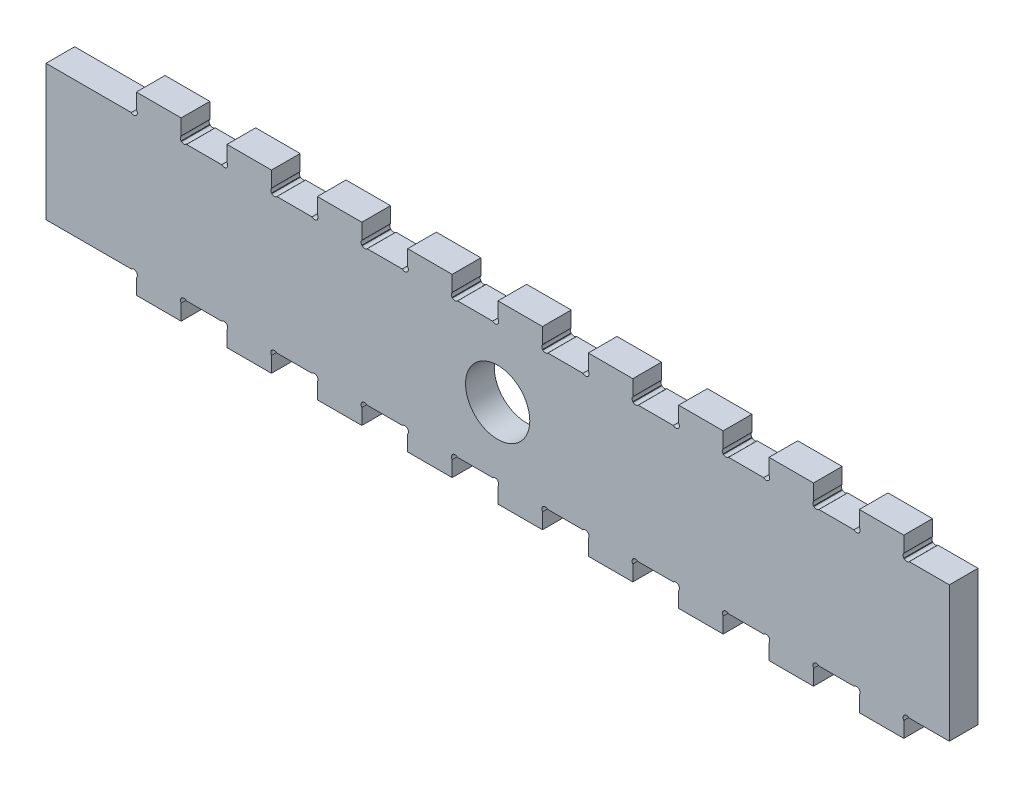
from build123d import *

# Parameters (mm, degrees)
BOSS_EXTRUDE1_DEPTH = 6.35
SKETCH1_R           = 7.112
CUT_EXTRUDE1_DEPTH  = 6.35
SKETCH2_W           = 10.1524
SKETCH2_H           = 7.304058312
SKETCH2_H_2         = 7.377109797
CUT_EXTRUDE2_DEPTH  = 204.051450213
LPATTERN1_COUNT     = 9
LPATTERN1_PITCH     = 20
SKETCH3_W           = 0.405797101
SKETCH3_H           = 2.992753623
CUT_EXTRUDE3_DEPTH  = 2.54


# Read off the part's stored shape, not the designer's step: Boss-Extrude1
with BuildPart() as part:
    # Boss-Extrude1 outline → Boss-Extrude1 (new body)
    with BuildSketch(Plane.XY):
        with BuildLine():
            Line((190, -4.490128061), (190, -1.122532015))
            ThreePointArc((190, -1.122532015), (190, 0), (191.122532015, 0))
            Line((191.122532015, 0), (200, 0))
            Line((200, 0), (200, 30))
            Line((200, 30), (191.122532015, 30))
            ThreePointArc((191.122532015, 30), (190, 30), (190, 31.122532015))
            Line((190, 31.122532015), (190, 34.490128061))
            Line((190, 34.490128061), (180, 34.490128061))
            Line((180, 34.490128061), (180, 31.122532015))
            ThreePointArc((180, 31.122532015), (180, 30), (178.877467985, 30))
            Line((178.877467985, 30), (171.122532015, 30))
            ThreePointArc((171.122532015, 30), (170, 30), (170, 31.122532015))
            Line((170, 31.122532015), (170, 34.490128061))
            Line((170, 34.490128061), (160, 34.490128061))
            Line((160, 34.490128061), (160, 31.122532015))
            ThreePointArc((160, 31.122532015), (160, 30), (158.877467985, 30))
            Line((158.877467985, 30), (151.122532015, 30))
            ThreePointArc((151.122532015, 30), (150, 30), (150, 31.122532015))
            Line((150, 31.122532015), (150, 34.490128061))
            Line((150, 34.490128061), (140, 34.490128061))
            Line((140, 34.490128061), (140, 31.122532015))
            ThreePointArc((140, 31.122532015), (140, 30), (138.877467985, 30))
            Line((138.877467985, 30), (131.122532015, 30))
            ThreePointArc((131.122532015, 30), (130, 30), (130, 31.122532015))
            Line((130, 31.122532015), (130, 34.490128061))
            Line((130, 34.490128061), (120, 34.490128061))
            Line((120, 34.490128061), (120, 31.122532015))
            ThreePointArc((120, 31.122532015), (120, 30), (118.877467985, 30))
            Line((118.877467985, 30), (111.122532015, 30))
            ThreePointArc((111.122532015, 30), (110, 30), (110, 31.122532015))
            Line((110, 31.122532015), (110, 34.490128061))
            Line((110, 34.490128061), (100, 34.490128061))
            Line((100, 34.490128061), (100, 31.122532015))
            ThreePointArc((100, 31.122532015), (100, 30), (98.877467985, 30))
            Line((98.877467985, 30), (91.122532015, 30))
            ThreePointArc((91.122532015, 30), (90, 30), (90, 31.122532015))
            Line((90, 31.122532015), (90, 34.490128061))
            Line((90, 34.490128061), (80, 34.490128061))
            Line((80, 34.490128061), (80, 31.122532015))
            ThreePointArc((80, 31.122532015), (80, 30), (78.877467985, 30))
            Line((78.877467985, 30), (71.122532015, 30))
            ThreePointArc((71.122532015, 30), (70, 30), (70, 31.122532015))
            Line((70, 31.122532015), (70, 34.490128061))
            Line((70, 34.490128061), (60, 34.490128061))
            Line((60, 34.490128061), (60, 31.122532015))
            ThreePointArc((60, 31.122532015), (60, 30), (58.877467985, 30))
            Line((58.877467985, 30), (51.122532015, 30))
            ThreePointArc((51.122532015, 30), (50, 30), (50, 31.122532015))
            Line((50, 31.122532015), (50, 34.490128061))
            Line((50, 34.490128061), (40, 34.490128061))
            Line((40, 34.490128061), (40, 31.122532015))
            ThreePointArc((40, 31.122532015), (40, 30), (38.877467985, 30))
            Line((38.877467985, 30), (31.122532015, 30))
            ThreePointArc((31.122532015, 30), (30, 30), (30, 31.122532015))
            Line((30, 31.122532015), (30, 34.490128061))
            Line((30, 34.490128061), (20, 34.490128061))
            Line((20, 34.490128061), (20, 31.122532015))
            ThreePointArc((20, 31.122532015), (20, 30), (18.877467985, 30))
            Line((18.877467985, 30), (0, 30))
            Line((0, 30), (0, 0))
            Line((0, 0), (18.877467985, 0))
            ThreePointArc((18.877467985, 0), (20, 0), (20, -1.122532015))
            Line((20, -1.122532015), (20, -4.490128061))
            Line((20, -4.490128061), (30, -4.490128061))
            Line((30, -4.490128061), (30, -1.122532015))
            ThreePointArc((30, -1.122532015), (30, 0), (31.122532015, 0))
            Line((31.122532015, 0), (38.877467985, 0))
            ThreePointArc((38.877467985, 0), (40, 0), (40, -1.122532015))
            Line((40, -1.122532015), (40, -4.490128061))
            Line((40, -4.490128061), (50, -4.490128061))
            Line((50, -4.490128061), (50, -1.122532015))
            ThreePointArc((50, -1.122532015), (50, 0), (51.122532015, 0))
            Line((51.122532015, 0), (58.877467985, 0))
            ThreePointArc((58.877467985, 0), (60, 0), (60, -1.122532015))
            Line((60, -1.122532015), (60, -4.490128061))
            Line((60, -4.490128061), (70, -4.490128061))
            Line((70, -4.490128061), (70, -1.122532015))
            ThreePointArc((70, -1.122532015), (70, 0), (71.122532015, 0))
            Line((71.122532015, 0), (78.877467985, 0))
            ThreePointArc((78.877467985, 0), (80, 0), (80, -1.122532015))
            Line((80, -1.122532015), (80, -4.490128061))
            Line((80, -4.490128061), (90, -4.490128061))
            Line((90, -4.490128061), (90, -1.122532015))
            ThreePointArc((90, -1.122532015), (90, 0), (91.122532015, 0))
            Line((91.122532015, 0), (98.877467985, 0))
            ThreePointArc((98.877467985, 0), (100, 0), (100, -1.122532015))
            Line((100, -1.122532015), (100, -4.490128061))
            Line((100, -4.490128061), (110, -4.490128061))
            Line((110, -4.490128061), (110, -1.122532015))
            ThreePointArc((110, -1.122532015), (110, 0), (111.122532015, 0))
            Line((111.122532015, 0), (118.877467985, 0))
            ThreePointArc((118.877467985, 0), (120, 0), (120, -1.122532015))
            Line((120, -1.122532015), (120, -4.490128061))
            Line((120, -4.490128061), (130, -4.490128061))
            Line((130, -4.490128061), (130, -1.122532015))
            ThreePointArc((130, -1.122532015), (130, 0), (131.122532015, 0))
            Line((131.122532015, 0), (138.877467985, 0))
            ThreePointArc((138.877467985, 0), (140, 0), (140, -1.122532015))
            Line((140, -1.122532015), (140, -4.490128061))
            Line((140, -4.490128061), (150, -4.490128061))
            Line((150, -4.490128061), (150, -1.122532015))
            ThreePointArc((150, -1.122532015), (150, 0), (151.122532015, 0))
            Line((151.122532015, 0), (158.877467985, 0))
            ThreePointArc((158.877467985, 0), (160, 0), (160, -1.122532015))
            Line((160, -1.122532015), (160, -4.490128061))
            Line((160, -4.490128061), (170, -4.490128061))
            Line((170, -4.490128061), (170, -1.122532015))
            ThreePointArc((170, -1.122532015), (170, 0), (171.122532015, 0))
            Line((171.122532015, 0), (178.877467985, 0))
            ThreePointArc((178.877467985, 0), (180, 0), (180, -1.122532015))
            Line((180, -1.122532015), (180, -4.490128061))
            Line((180, -4.490128061), (190, -4.490128061))
        make_face()
    extrude(amount=BOSS_EXTRUDE1_DEPTH)

    # Sketch1 → Cut-Extrude1 (cut)
    with BuildSketch(Plane.XY.offset(6.35)):
        with Locations((100, 15)):
            Circle(SKETCH1_R)
    extrude(amount=-CUT_EXTRUDE1_DEPTH, mode=Mode.SUBTRACT)

    # Sketch2 → Cut-Extrude2 (cut, through all)
    with BuildSketch(Plane(origin=(0, 0, 0), x_dir=(-1, 0, 0), z_dir=(0, 0, -1))):
        with Locations((-35, 33.652029156)):
            Rectangle(SKETCH2_W, SKETCH2_H)
        with Locations((-35, -3.688554899)):
            Rectangle(SKETCH2_W, SKETCH2_H_2)
    cut_extrude2 = extrude(amount=-CUT_EXTRUDE2_DEPTH, mode=Mode.SUBTRACT)

    # LPattern1: Cut-Extrude2 ×9
    with Locations(*[(i * LPATTERN1_PITCH, 0, 0) for i in range(1, LPATTERN1_COUNT)]):
        add(cut_extrude2, mode=Mode.SUBTRACT)

    # Sketch3 → Cut-Extrude3 (cut)
    # profile 1 of 7: a face of its own
    with BuildSketch(Plane(origin=(0, 0, 0), x_dir=(-1, 0, 0), z_dir=(0, 0, -1))):
        with BuildLine():
            add(Edge.make_bspline(
                [(-198.628550725, 24.369565217), (-198.652091106, 24.439191511), (-198.699135289, 24.578335901), (-198.745555146, 24.794359971), (-198.775410316, 25.014667784), (-198.778944977, 25.163359913), (-198.780724638, 25.238224638)],
                knots=[0, 0, 0, 0, 0.994488486, 1.987431555, 2.986695647, 4, 4, 4, 4], degree=3))
            add(Edge.make_bspline(
                [(-198.780724638, 25.238224638), (-198.779347085, 25.297460952), (-198.776663168, 25.412872458), (-198.756085396, 25.580662162), (-198.721119452, 25.737744864), (-198.673168798, 25.884474831), (-198.610110067, 26.020428138), (-198.532689936, 26.145543054), (-198.441960032, 26.260398052), (-198.337221232, 26.364303624), (-198.218447884, 26.456463783), (-198.086243147, 26.536614633), (-197.940656127, 26.604476934), (-197.781519009, 26.658475676), (-197.609441868, 26.701242062), (-197.424480067, 26.731816669), (-197.226065436, 26.750081143), (-197.089415041, 26.752416825), (-197.018836051, 26.753623188)],
                knots=[0, 0, 0, 0, 1.072521388, 2.089618652, 3.055324458, 3.982727964, 4.879567488, 5.762479147, 6.641155072, 7.524105616, 8.427505607, 9.357127668, 10.318129176, 11.330308756, 12.395495865, 13.525717698, 14.722050183, 16, 16, 16, 16], degree=3))
            add(Edge.make_bspline(
                [(-197.018836051, 26.753623188), (-196.950103159, 26.752155775), (-196.815516836, 26.749282423), (-196.618803095, 26.729705951), (-196.432233617, 26.695550584), (-196.256545532, 26.648126232), (-196.091928662, 26.588981407), (-195.939702067, 26.517586195), (-195.800493439, 26.434277415), (-195.674329672, 26.33965593), (-195.561855768, 26.233370591), (-195.462239526, 26.116752761), (-195.377108527, 25.988802962), (-195.305406147, 25.85136377), (-195.248937918, 25.704059913), (-195.208791146, 25.547722279), (-195.183349726, 25.382777221), (-195.180652245, 25.269758309), (-195.179275362, 25.212069746)],
                knots=[0, 0, 0, 0, 1.219601586, 2.388109825, 3.503461938, 4.581531402, 5.613672394, 6.603499858, 7.560235823, 8.487517701, 9.396185618, 10.300781163, 11.203126632, 12.117328385, 13.046279645, 13.9957175, 14.976948417, 16, 16, 16, 16], degree=3))
            add(Edge.make_bspline(
                [(-195.179275362, 25.212069746), (-195.17969203, 25.17269137), (-195.180512088, 25.095189507), (-195.188153972, 24.981275299), (-195.198571411, 24.871381126), (-195.221082705, 24.731979193), (-195.25962679, 24.562811061), (-195.307559555, 24.433842986), (-195.331449275, 24.369565217)],
                knots=[0, 0, 0, 0, 0.822626155, 1.619037258, 2.384688107, 3.12792479, 4.568555946, 6, 6, 6, 6], degree=3))
            Line((-195.331449275, 24.369565217), (-195.787971014, 24.369565217))
            add(Edge.make_bspline(
                [(-195.787971014, 24.369565217), (-195.771985551, 24.400815403), (-195.740307718, 24.462742802), (-195.699927539, 24.55872837), (-195.664844647, 24.655975609), (-195.63631946, 24.755860436), (-195.612971413, 24.858698111), (-195.59632813, 24.965914875), (-195.586881132, 25.077687731), (-195.585681673, 25.153665912), (-195.585072464, 25.192255435)],
                knots=[0, 0, 0, 0, 0.983572694, 1.949111623, 2.916466222, 3.879730749, 4.858833143, 5.870548135, 6.918445666, 8, 8, 8, 8], degree=3))
            add(Edge.make_bspline(
                [(-195.585072464, 25.192255435), (-195.585947203, 25.231700985), (-195.58766552, 25.309186906), (-195.606833914, 25.42204973), (-195.635816185, 25.5293889), (-195.677440027, 25.630349389), (-195.729539701, 25.725178012), (-195.793789159, 25.812032779), (-195.867958619, 25.89181496), (-195.952664586, 25.964135823), (-196.047006936, 26.029350904), (-196.152107873, 26.085484325), (-196.26639413, 26.135049627), (-196.391146352, 26.174629457), (-196.524711114, 26.207645601), (-196.667626451, 26.230094657), (-196.819636076, 26.243650033), (-196.923962023, 26.245450657), (-196.977622283, 26.246376812)],
                knots=[0, 0, 0, 0, 0.961465539, 1.888680529, 2.784722735, 3.669285122, 4.546395053, 5.417897658, 6.298128314, 7.19861075, 8.13011739, 9.090545283, 10.101099583, 11.165124917, 12.279780303, 13.454963993, 14.690955624, 16, 16, 16, 16], degree=3))
            add(Edge.make_bspline(
                [(-196.977622283, 26.246376812), (-197.03365404, 26.245720053), (-197.142173332, 26.244448078), (-197.299710917, 26.231720546), (-197.446551705, 26.210220218), (-197.583433317, 26.181957695), (-197.708874063, 26.142243707), (-197.824889035, 26.097352966), (-197.929117691, 26.04111991), (-198.023311652, 25.977915687), (-198.106482041, 25.906160975), (-198.17860395, 25.825998331), (-198.239913979, 25.738003899), (-198.289142503, 25.641506693), (-198.328612289, 25.538040835), (-198.354730778, 25.426035645), (-198.372063314, 25.306662465), (-198.373955209, 25.22428789), (-198.374927536, 25.181951993)],
                knots=[0, 0, 0, 0, 1.344734694, 2.604409767, 3.789983137, 4.905641868, 5.954647261, 6.944970549, 7.886844079, 8.790877712, 9.663034665, 10.516172657, 11.372838457, 12.229363423, 13.110351235, 14.023942263, 14.984417489, 16, 16, 16, 16], degree=3))
            add(Edge.make_bspline(
                [(-198.374927536, 25.181951993), (-198.374407016, 25.145466), (-198.373375149, 25.073137135), (-198.36240331, 24.965710061), (-198.346128184, 24.860567922), (-198.315197481, 24.724029413), (-198.261925741, 24.557868516), (-198.202009226, 24.432363681), (-198.172028986, 24.369565217)],
                knots=[0, 0, 0, 0, 0.776679327, 1.539668523, 2.297162527, 3.040996235, 4.519412489, 6, 6, 6, 6], degree=3))
            Line((-198.172028986, 24.369565217), (-198.628550725, 24.369565217))
        make_face()
    # profile 2 of 7: a face of its own
    with BuildSketch(Plane(origin=(0, 0, 0), x_dir=(-1, 0, 0), z_dir=(0, 0, -1))):
        Polygon((-195.635797101, 22.746376812), (-195.635797101, 23.557971014), (-195.23, 23.557971014), (-195.23, 21.427536232), (-195.635797101, 21.427536232), (-195.635797101, 22.239130435), (-198.324202899, 22.239130435), (-198.324202899, 21.427536232), (-198.73, 21.427536232), (-198.73, 23.557971014), (-198.324202899, 23.557971014), (-198.324202899, 22.746376812), align=None)
    # profile 3 of 7: a face of its own
    with BuildSketch(Plane(origin=(0, 0, 0), x_dir=(-1, 0, 0), z_dir=(0, 0, -1))):
        with Locations((-199.643043479, 19.525362319)):
            Rectangle(SKETCH3_W, SKETCH3_H)
    # profile 4 of 7: a face of its own
    with BuildSketch(Plane(origin=(0, 0, 0), x_dir=(-1, 0, 0), z_dir=(0, 0, -1))):
        Polygon((-198.73, 15.061594203), (-198.73, 15.580729167), (-197.969130435, 15.815330616), (-197.969130435, 17.268908514), (-198.73, 17.509057971), (-198.73, 18.003623188), (-195.23, 16.840126812), (-195.23, 16.187839674), align=None)
        Polygon((-197.563333333, 15.939764493), (-195.638174819, 16.532608696), (-197.563333333, 17.140511775), align=None, mode=Mode.SUBTRACT)
    # profile 5 of 7: a face of its own
    with BuildSketch(Plane(origin=(0, 0, 0), x_dir=(-1, 0, 0), z_dir=(0, 0, -1))):
        with BuildLine():
            add(Edge.make_bspline(
                [(-195.787971014, 12.297101449), (-195.758065487, 12.364719535), (-195.698633579, 12.499098433), (-195.644593663, 12.675388841), (-195.613753257, 12.820356717), (-195.597331573, 12.934200304), (-195.586620083, 13.052745172), (-195.585593364, 13.133505723), (-195.585072464, 13.174479167)],
                knots=[0, 0, 0, 0, 1.464330601, 2.910096185, 3.643252908, 4.399959025, 5.188227586, 6, 6, 6, 6], degree=3))
            add(Edge.make_bspline(
                [(-195.585072464, 13.174479167), (-195.586204516, 13.221050347), (-195.588414289, 13.311957546), (-195.60808439, 13.443881629), (-195.63848755, 13.568305963), (-195.683210034, 13.684022313), (-195.739190866, 13.791640272), (-195.804700579, 13.891532237), (-195.882477857, 13.981229151), (-195.969296167, 14.062584915), (-196.065970817, 14.135209996), (-196.172349831, 14.19846706), (-196.288238068, 14.252489271), (-196.41265626, 14.297421392), (-196.545176904, 14.333210714), (-196.684977312, 14.357871625), (-196.831379531, 14.37469955), (-196.9313393, 14.376097709), (-196.982377717, 14.376811594)],
                knots=[0, 0, 0, 0, 1.07383125, 2.096124485, 3.070298713, 4.02338534, 4.950249423, 5.864786912, 6.772474448, 7.682348964, 8.605135898, 9.556349748, 10.532485908, 11.550518582, 12.604692889, 13.695003331, 14.823092702, 16, 16, 16, 16], degree=3))
            add(Edge.make_bspline(
                [(-196.982377717, 14.376811594), (-197.035502414, 14.376086857), (-197.138721763, 14.374678718), (-197.289623519, 14.362719164), (-197.431811509, 14.342401257), (-197.565542842, 14.31380728), (-197.690327166, 14.278140983), (-197.805382333, 14.231992465), (-197.910391713, 14.176195045), (-198.006375184, 14.112375027), (-198.090800818, 14.037780546), (-198.165706995, 13.954709422), (-198.229039049, 13.861117618), (-198.282931715, 13.758279391), (-198.32370158, 13.64453419), (-198.354083613, 13.521124466), (-198.371165562, 13.386834118), (-198.373643612, 13.293940567), (-198.374927536, 13.245810688)],
                knots=[0, 0, 0, 0, 1.243320526, 2.415726445, 3.540355266, 4.602811121, 5.614475227, 6.574453135, 7.498382402, 8.393662059, 9.265660112, 10.128400087, 11.004859636, 11.903741185, 12.83886003, 13.825727115, 14.873468712, 16, 16, 16, 16], degree=3))
            add(Edge.make_bspline(
                [(-198.374927536, 13.245810688), (-198.374546099, 13.228103531), (-198.373753956, 13.191330453), (-198.369601191, 13.134759476), (-198.363477223, 13.076043864), (-198.354611486, 13.01715216), (-198.344537474, 12.959168116), (-198.33214436, 12.90354218), (-198.317385242, 12.851989225), (-198.30586241, 12.819620154), (-198.300425725, 12.804347826)],
                knots=[0, 0, 0, 0, 0.945094064, 1.962710246, 3.026179144, 4.094962389, 5.140426656, 6.16660256, 7.134969076, 8, 8, 8, 8], degree=3))
            Line((-198.300425725, 12.804347826), (-197.157536232, 12.804347826))
            Line((-197.157536232, 12.804347826), (-197.157536232, 13.508152174))
            Line((-197.157536232, 13.508152174), (-196.75173913, 13.508152174))
            Line((-196.75173913, 13.508152174), (-196.75173913, 12.297101449))
            Line((-196.75173913, 12.297101449), (-198.5659375, 12.297101449))
            add(Edge.make_bspline(
                [(-198.5659375, 12.297101449), (-198.582790401, 12.335215917), (-198.617018388, 12.412625824), (-198.660080531, 12.53373683), (-198.69700215, 12.659239877), (-198.728069011, 12.787463063), (-198.751627607, 12.916636127), (-198.768020126, 13.045237595), (-198.778979056, 13.17111834), (-198.780150817, 13.25424325), (-198.780724638, 13.294950181)],
                knots=[0, 0, 0, 0, 0.972423304, 1.974976993, 2.997359869, 4.024843793, 5.052901157, 6.060203398, 7.050066144, 8, 8, 8, 8], degree=3))
            add(Edge.make_bspline(
                [(-198.780724638, 13.294950181), (-198.779450472, 13.354729442), (-198.776961194, 13.471517411), (-198.754725954, 13.641989994), (-198.720516493, 13.80351653), (-198.671243232, 13.95579251), (-198.607947956, 14.097650755), (-198.531321426, 14.229291271), (-198.440484864, 14.349446549), (-198.335921929, 14.458712654), (-198.217922417, 14.55663089), (-198.086258356, 14.642930726), (-197.940317289, 14.715275915), (-197.78155806, 14.776818182), (-197.609245408, 14.824709198), (-197.423938433, 14.859418785), (-197.225636355, 14.88006195), (-197.089160952, 14.882699077), (-197.018836051, 14.884057971)],
                knots=[0, 0, 0, 0, 1.06370665, 2.078114337, 3.054979398, 3.999380594, 4.92145651, 5.815163411, 6.704963933, 7.596415903, 8.501447596, 9.428880987, 10.392157234, 11.395659057, 12.455751986, 13.570903998, 14.748302397, 16, 16, 16, 16], degree=3))
            add(Edge.make_bspline(
                [(-197.018836051, 14.884057971), (-196.948763813, 14.882522928), (-196.811664769, 14.879519556), (-196.611913448, 14.856504497), (-196.423212345, 14.817801115), (-196.246648094, 14.763062563), (-196.081834859, 14.694893777), (-195.929970855, 14.613954562), (-195.79053864, 14.520841342), (-195.665096638, 14.414168023), (-195.552726883, 14.295791518), (-195.454879074, 14.16548349), (-195.369917255, 14.024630708), (-195.301564173, 13.871772551), (-195.246983539, 13.710133059), (-195.206759429, 13.539910352), (-195.183965013, 13.3613579), (-195.18085511, 13.239533151), (-195.179275362, 13.177649457)],
                knots=[0, 0, 0, 0, 1.187685027, 2.323751684, 3.40325322, 4.448706947, 5.452612453, 6.422370454, 7.361444742, 8.289291529, 9.2080357, 10.122578476, 11.046580091, 11.990639292, 12.95512931, 13.935010878, 14.951041083, 16, 16, 16, 16], degree=3))
            add(Edge.make_bspline(
                [(-195.179275362, 13.177649457), (-195.180706246, 13.098828558), (-195.183510171, 12.944372973), (-195.208032801, 12.75437246), (-195.235079926, 12.60817197), (-195.261684758, 12.50217479), (-195.292921339, 12.398279939), (-195.318625898, 12.330777013), (-195.331449275, 12.297101449)],
                knots=[0, 0, 0, 0, 1.577575484, 3.091379944, 3.829084024, 4.554025386, 5.278638522, 6, 6, 6, 6], degree=3))
            Line((-195.331449275, 12.297101449), (-195.787971014, 12.297101449))
        make_face()
    # profile 6 of 7: a face of its own
    with BuildSketch(Plane(origin=(0, 0, 0), x_dir=(-1, 0, 0), z_dir=(0, 0, -1))):
        Polygon((-198.73, 9.076086957), (-198.73, 9.59522192), (-197.969130435, 9.82982337), (-197.969130435, 11.283401268), (-198.73, 11.523550725), (-198.73, 12.018115942), (-195.23, 10.854619565), (-195.23, 10.202332428), align=None)
        Polygon((-197.563333333, 9.954257246), (-195.638174819, 10.547101449), (-197.563333333, 11.155004529), align=None, mode=Mode.SUBTRACT)
    # profile 7 of 7: a face of its own
    with BuildSketch(Plane(origin=(0, 0, 0), x_dir=(-1, 0, 0), z_dir=(0, 0, -1))):
        with BuildLine():
            Line((-198.73, 6.260869565), (-198.73, 6.798233696))
            Line((-198.73, 6.798233696), (-197.637042572, 7.30151721))
            add(Edge.make_bspline(
                [(-197.637042572, 7.30151721), (-197.598368814, 7.319810479), (-197.526751264, 7.353686655), (-197.431428969, 7.411807065), (-197.356587471, 7.47446239), (-197.29692141, 7.540310826), (-197.255318839, 7.613431291), (-197.226920805, 7.692560342), (-197.211328641, 7.779614455), (-197.20931373, 7.840404486), (-197.20826087, 7.872169384)],
                knots=[0, 0, 0, 0, 1.338772992, 2.479191189, 3.482945241, 4.385349486, 5.244905147, 6.097671477, 7.005967435, 8, 8, 8, 8], degree=3))
            Line((-197.20826087, 7.872169384), (-197.20826087, 8.086956522))
            Line((-197.20826087, 8.086956522), (-198.73, 8.086956522))
            Line((-198.73, 8.086956522), (-198.73, 8.594202899))
            Line((-198.73, 8.594202899), (-195.23, 8.594202899))
            Line((-195.23, 8.594202899), (-195.23, 7.663722826))
            add(Edge.make_bspline(
                [(-195.23, 7.663722826), (-195.230633681, 7.614816511), (-195.231855432, 7.520524022), (-195.244733393, 7.384374104), (-195.265510948, 7.258872503), (-195.2958998, 7.144203961), (-195.333062074, 7.039620985), (-195.377372069, 6.944664355), (-195.429106457, 6.859489304), (-195.486866488, 6.783574017), (-195.551695183, 6.717889924), (-195.622982227, 6.662033336), (-195.700206337, 6.614757232), (-195.784086439, 6.577732402), (-195.87286988, 6.549177769), (-195.966715871, 6.529823378), (-196.064721142, 6.516409727), (-196.131900557, 6.515138529), (-196.16602808, 6.514492754)],
                knots=[0, 0, 0, 0, 1.390044527, 2.680037511, 3.883980252, 5.002591534, 6.047945171, 7.035778823, 7.976126261, 8.876006873, 9.741730367, 10.592201103, 11.444957297, 12.309017474, 13.19263937, 14.091265268, 15.030351984, 16, 16, 16, 16], degree=3))
            add(Edge.make_bspline(
                [(-196.16602808, 6.514492754), (-196.19353009, 6.515125619), (-196.247616192, 6.516370226), (-196.327580321, 6.525533445), (-196.405363876, 6.539368467), (-196.480525135, 6.560244175), (-196.553174473, 6.586099256), (-196.621924636, 6.61913162), (-196.68842101, 6.6561696), (-196.75088728, 6.699925727), (-196.809766055, 6.749236292), (-196.864420423, 6.80386574), (-196.914815954, 6.864232239), (-196.961648821, 6.929517324), (-197.002686287, 7.001096389), (-197.038371273, 7.077468483), (-197.068806927, 7.158530918), (-197.084023581, 7.214984451), (-197.091752717, 7.24365942)],
                knots=[0, 0, 0, 0, 1.032694101, 2.030920574, 3.019583514, 3.996878393, 4.957355827, 5.911663108, 6.858097115, 7.813229385, 8.771140752, 9.739377272, 10.711267527, 11.72169873, 12.753057245, 13.805067188, 14.88510732, 16, 16, 16, 16], degree=3))
            add(Edge.make_bspline(
                [(-197.091752717, 7.24365942), (-197.100305671, 7.220355499), (-197.117275303, 7.174118962), (-197.154987749, 7.110472822), (-197.199229573, 7.050762528), (-197.254499453, 6.997538881), (-197.318584152, 6.947432406), (-197.391007277, 6.896527469), (-197.473265505, 6.845151069), (-197.532512749, 6.812724416), (-197.563333333, 6.795855978)],
                knots=[0, 0, 0, 0, 0.890743625, 1.767294885, 2.648772936, 3.555528392, 4.515309866, 5.572047532, 6.736972216, 8, 8, 8, 8], degree=3))
            Line((-197.563333333, 6.795855978), (-198.73, 6.260869565))
        make_face()
        with BuildLine():
            add(Edge.make_bspline(
                [(-196.200108696, 7.02173913), (-196.177101519, 7.022110674), (-196.132524064, 7.022830557), (-196.067991964, 7.030782362), (-196.008094569, 7.044421751), (-195.952530226, 7.062485514), (-195.901182995, 7.085358973), (-195.854687722, 7.114351523), (-195.812648366, 7.14845609), (-195.775072962, 7.187574159), (-195.742428373, 7.231725379), (-195.714072938, 7.280220201), (-195.68912942, 7.332812596), (-195.66951074, 7.390019058), (-195.654723526, 7.451383084), (-195.643381609, 7.516740306), (-195.63732045, 7.586464647), (-195.636313553, 7.634387229), (-195.635797101, 7.658967391)],
                knots=[0, 0, 0, 0, 1.135705444, 2.200481127, 3.203777096, 4.165053602, 5.081738276, 5.972335559, 6.862741706, 7.74854822, 8.64353036, 9.567612247, 10.518921536, 11.513271118, 12.547969405, 13.633248542, 14.786060067, 16, 16, 16, 16], degree=3))
            Line((-195.635797101, 7.658967391), (-195.635797101, 8.086956522))
            Line((-195.635797101, 8.086956522), (-196.802463768, 8.086956522))
            Line((-196.802463768, 8.086956522), (-196.802463768, 7.719995471))
            add(Edge.make_bspline(
                [(-196.802463768, 7.719995471), (-196.801996215, 7.693829708), (-196.801082896, 7.642717522), (-196.79430675, 7.568158398), (-196.78094481, 7.49791407), (-196.765123744, 7.43130186), (-196.742756877, 7.369240846), (-196.715357692, 7.312019155), (-196.68515513, 7.25827346), (-196.647951467, 7.210908752), (-196.607737769, 7.167423275), (-196.561970552, 7.130274472), (-196.512444615, 7.097420385), (-196.458481614, 7.069391242), (-196.399543828, 7.048096604), (-196.33646598, 7.033368568), (-196.269641357, 7.023382476), (-196.223659602, 7.022295736), (-196.200108696, 7.02173913)],
                knots=[0, 0, 0, 0, 1.202317658, 2.348606605, 3.434356298, 4.485418642, 5.491423006, 6.45798419, 7.399054253, 8.316817859, 9.218464177, 10.115276335, 11.017576138, 11.945955617, 12.902170755, 13.888501297, 14.918533897, 16, 16, 16, 16], degree=3))
        make_face(mode=Mode.SUBTRACT)
    extrude(amount=-CUT_EXTRUDE3_DEPTH, mode=Mode.SUBTRACT)


solid = part.part
